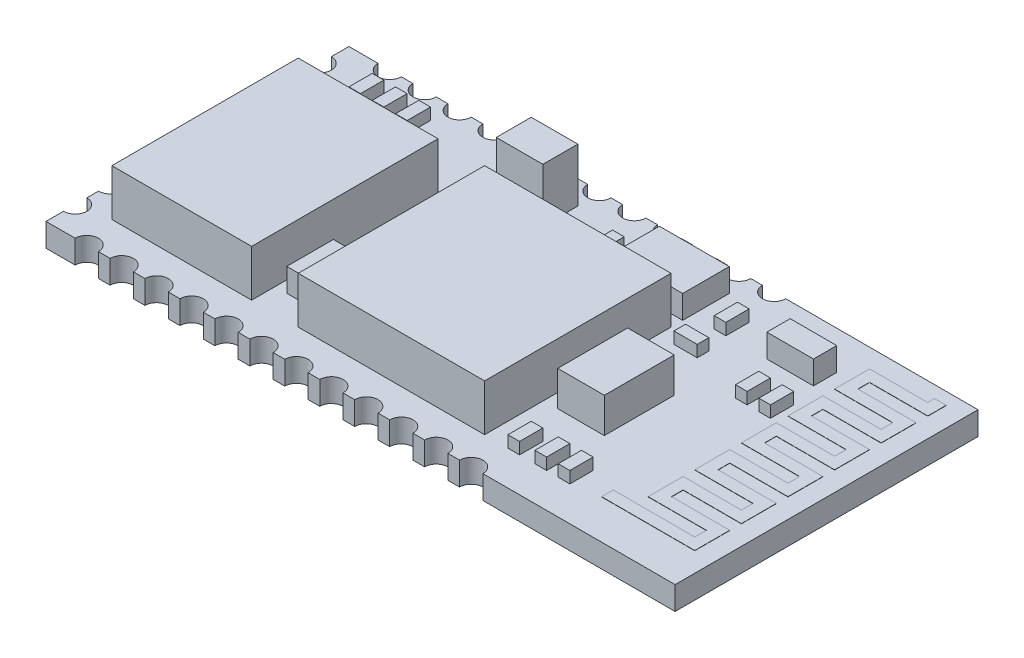
from build123d import *

# Parameters (mm, degrees)
SKETCH1_W           = 27
SKETCH1_H           = 13
BOSS_EXTRUDE1_DEPTH = 1
SKETCH2_R           = 0.5
CUT_EXTRUDE7_DEPTH  = 2
SKETCH9_R           = 0.5
CUT_EXTRUDE9_DEPTH  = 2
SKETCH10_W          = 6
SKETCH10_H          = 8
SKETCH10_W_2        = 8
BOSS_EXTRUDE2_DEPTH = 2
SKETCH12_W          = 3
SKETCH12_H          = 2
BOSS_EXTRUDE3_DEPTH = 1
SKETCH13_W          = 2
SKETCH13_H          = 1.5
BOSS_EXTRUDE4_DEPTH = 2.3
SKETCH14_W          = 0.5
SKETCH14_H          = 1
SKETCH14_W_2        = 1
SKETCH14_H_2        = 0.5
BOSS_EXTRUDE6_DEPTH = 0.5
SKETCH15_W          = 2
SKETCH15_H          = 1
SKETCH15_W_2        = 1
SKETCH15_H_2        = 2
BOSS_EXTRUDE7_DEPTH = 1
SKETCH16_W          = 2
SKETCH16_H          = 3
BOSS_EXTRUDE8_DEPTH = 1.5
BOSS_EXTRUDE9_DEPTH = 0.01


with BuildPart() as part:
    # Sketch1 → Boss-Extrude1 (new body)
    with BuildSketch(Plane(origin=(0, 0, 0), x_dir=(1, 0, 0), z_dir=(0, 1, 0))):
        Rectangle(SKETCH1_W, SKETCH1_H)
    extrude(amount=BOSS_EXTRUDE1_DEPTH)

    # Sketch2 → Cut-Extrude7 (cut)
    with BuildSketch(Plane(origin=(0, 1, 0), x_dir=(1, 0, 0), z_dir=(0, 1, 0))):
        with Locations((-13.5, 5.25)):
            Circle(SKETCH2_R)
        with Locations((-13.5, 3.75)):
            Circle(SKETCH2_R)
        with Locations((-13.5, 2.25)):
            Circle(SKETCH2_R)
        with Locations((-13.5, 0.75)):
            Circle(SKETCH2_R)
        with Locations((-13.5, -0.75)):
            Circle(SKETCH2_R)
        with Locations((-13.5, -2.25)):
            Circle(SKETCH2_R)
        with Locations((-13.5, -3.75)):
            Circle(SKETCH2_R)
        with Locations((-13.5, -5.25)):
            Circle(SKETCH2_R)
    extrude(amount=-CUT_EXTRUDE7_DEPTH, mode=Mode.SUBTRACT)

    # Sketch9 → Cut-Extrude9 (cut)
    with BuildSketch(Plane(origin=(0, 1, 0), x_dir=(1, 0, 0), z_dir=(0, 1, 0))):
        with Locations((-11.75, 6.5)):
            Circle(SKETCH9_R)
        with Locations((-10.25, 6.5)):
            Circle(SKETCH9_R)
        with Locations((-8.75, 6.5)):
            Circle(SKETCH9_R)
        with Locations((-7.25, 6.5)):
            Circle(SKETCH9_R)
        with Locations((-5.75, 6.5)):
            Circle(SKETCH9_R)
        with Locations((-4.25, 6.5)):
            Circle(SKETCH9_R)
        with Locations((-2.75, 6.5)):
            Circle(SKETCH9_R)
        with Locations((-1.25, 6.5)):
            Circle(SKETCH9_R)
        with Locations((0.25, 6.5)):
            Circle(SKETCH9_R)
        with Locations((1.75, 6.5)):
            Circle(SKETCH9_R)
        with Locations((3.25, 6.5)):
            Circle(SKETCH9_R)
        with Locations((4.75, 6.5)):
            Circle(SKETCH9_R)
        with Locations((4.75, -6.5)):
            Circle(SKETCH9_R)
        with Locations((3.25, -6.5)):
            Circle(SKETCH9_R)
        with Locations((1.75, -6.5)):
            Circle(SKETCH9_R)
        with Locations((0.25, -6.5)):
            Circle(SKETCH9_R)
        with Locations((-1.25, -6.5)):
            Circle(SKETCH9_R)
        with Locations((-2.75, -6.5)):
            Circle(SKETCH9_R)
        with Locations((-4.25, -6.5)):
            Circle(SKETCH9_R)
        with Locations((-5.75, -6.5)):
            Circle(SKETCH9_R)
        with Locations((-7.25, -6.5)):
            Circle(SKETCH9_R)
        with Locations((-8.75, -6.5)):
            Circle(SKETCH9_R)
        with Locations((-10.25, -6.5)):
            Circle(SKETCH9_R)
        with Locations((-11.75, -6.5)):
            Circle(SKETCH9_R)
    extrude(amount=-CUT_EXTRUDE9_DEPTH, mode=Mode.SUBTRACT)

    # Sketch10 → Boss-Extrude2 (add)
    with BuildSketch(Plane(origin=(0, 1, 0), x_dir=(1, 0, 0), z_dir=(0, 1, 0))):
        with Locations((-9.158592774, -1.016549072)):
            Rectangle(SKETCH10_W, SKETCH10_H)
        with Locations((-0.158592774, -1.016549072)):
            Rectangle(SKETCH10_W_2, SKETCH10_H)
    extrude(amount=BOSS_EXTRUDE2_DEPTH)

    # Sketch12 → Boss-Extrude3 (add)
    with BuildSketch(Plane(origin=(0, 1, 0), x_dir=(1, 0, 0), z_dir=(0, 1, 0))):
        with Locations((2.341407226, 4.483450928)):
            Rectangle(SKETCH12_W, SKETCH12_H)
    extrude(amount=BOSS_EXTRUDE3_DEPTH)

    # Sketch13 → Boss-Extrude4 (add)
    with BuildSketch(Plane(origin=(0, 1, 0), x_dir=(1, 0, 0), z_dir=(0, 1, 0))):
        with Locations((-3.658592774, 4.733450928)):
            Rectangle(SKETCH13_W, SKETCH13_H)
    extrude(amount=BOSS_EXTRUDE4_DEPTH)

    # Sketch14 → Boss-Extrude6 (add)
    with BuildSketch(Plane(origin=(0, 1, 0), x_dir=(1, 0, 0), z_dir=(0, 1, 0))):
        with Locations((-11.25, 5)):
            Rectangle(SKETCH14_W, SKETCH14_H)
        with Locations((-10.25, 5)):
            Rectangle(SKETCH14_W, SKETCH14_H)
        with Locations((-9.25, 5)):
            Rectangle(SKETCH14_W, SKETCH14_H)
        with Locations((6.25, -4.516549072)):
            Rectangle(SKETCH14_W, SKETCH14_H)
        with Locations((7.25, -4.516549072)):
            Rectangle(SKETCH14_W, SKETCH14_H)
        with Locations((5.091407226, -4.516549072)):
            Rectangle(SKETCH14_W, SKETCH14_H)
        with Locations((9.116137584, 2.225585846)):
            Rectangle(SKETCH14_W, SKETCH14_H)
        with Locations((8.116137584, 2.225585846)):
            Rectangle(SKETCH14_W, SKETCH14_H)
        with Locations((-5.158592774, 3)):
            Rectangle(SKETCH14_W, SKETCH14_H)
        with Locations((5.091407226, 4.336621963)):
            Rectangle(SKETCH14_W, SKETCH14_H)
        with Locations((-5.158592774, 0)):
            Rectangle(SKETCH14_W, SKETCH14_H)
        with Locations((-0.270236952, 4.336621963)):
            Rectangle(SKETCH14_W, SKETCH14_H)
        with Locations((5.045928456, 2.653097674)):
            Rectangle(SKETCH14_W_2, SKETCH14_H_2)
    extrude(amount=BOSS_EXTRUDE6_DEPTH)

    # Sketch15 → Boss-Extrude7 (add)
    with BuildSketch(Plane(origin=(0, 1, 0), x_dir=(1, 0, 0), z_dir=(0, 1, 0))):
        with Locations((8.084421652, 4.353233129)):
            Rectangle(SKETCH15_W, SKETCH15_H)
        with Locations((-5.160364115, -3.004825478)):
            Rectangle(SKETCH15_W_2, SKETCH15_H_2)
    extrude(amount=BOSS_EXTRUDE7_DEPTH)

    # Sketch16 → Boss-Extrude8 (add)
    with BuildSketch(Plane(origin=(0, 1, 0), x_dir=(1, 0, 0), z_dir=(0, 1, 0))):
        with Locations((5.444247196, -0.981381649)):
            Rectangle(SKETCH16_W, SKETCH16_H)
    extrude(amount=BOSS_EXTRUDE8_DEPTH)

    # Sketch17 → Boss-Extrude9 (add)
    with BuildSketch(Plane(origin=(0, 1, 0), x_dir=(1, 0, 0), z_dir=(0, 1, 0))):
        Polygon((12.163913607, 5.68064174), (9.663913607, 5.68064174), (9.663913607, 4.18064174), (12.163913607, 4.18064174), (12.163913607, 3.68064174), (9.663913607, 3.68064174), (9.663913607, 2.18064174), (12.163913607, 2.18064174), (12.163913607, 1.68064174), (9.663913607, 1.68064174), (9.663913607, 0.18064174), (12.163913607, 0.18064174), (12.163913607, -0.31935826), (9.663913607, -0.31935826), (9.663913607, -1.81935826), (12.163913607, -1.81935826), (12.163913607, -2.31935826), (9.663913607, -2.31935826), (9.663913607, -3.81935826), (12.163913607, -3.81935826), (12.163913607, -4.31935826), (8.663913607, -4.31935826), (8.663913607, -4.81935826), (12.663913607, -4.81935826), (12.663913607, -3.31935826), (10.163913607, -3.31935826), (10.163913607, -2.81935826), (12.663913607, -2.81935826), (12.663913607, -1.31935826), (10.163913607, -1.31935826), (10.163913607, -0.81935826), (12.663913607, -0.81935826), (12.663913607, 0.68064174), (10.163913607, 0.68064174), (10.163913607, 1.18064174), (12.663913607, 1.18064174), (12.663913607, 2.68064174), (10.163913607, 2.68064174), (10.163913607, 3.18064174), (12.663913607, 3.18064174), (12.663913607, 4.68064174), (10.163913607, 4.68064174), (10.163913607, 5.18064174), (12.663913607, 5.18064174), (12.663913607, 5.975044168), (12.163913607, 5.975044168), align=None)
    extrude(amount=BOSS_EXTRUDE9_DEPTH)


solid = part.part
